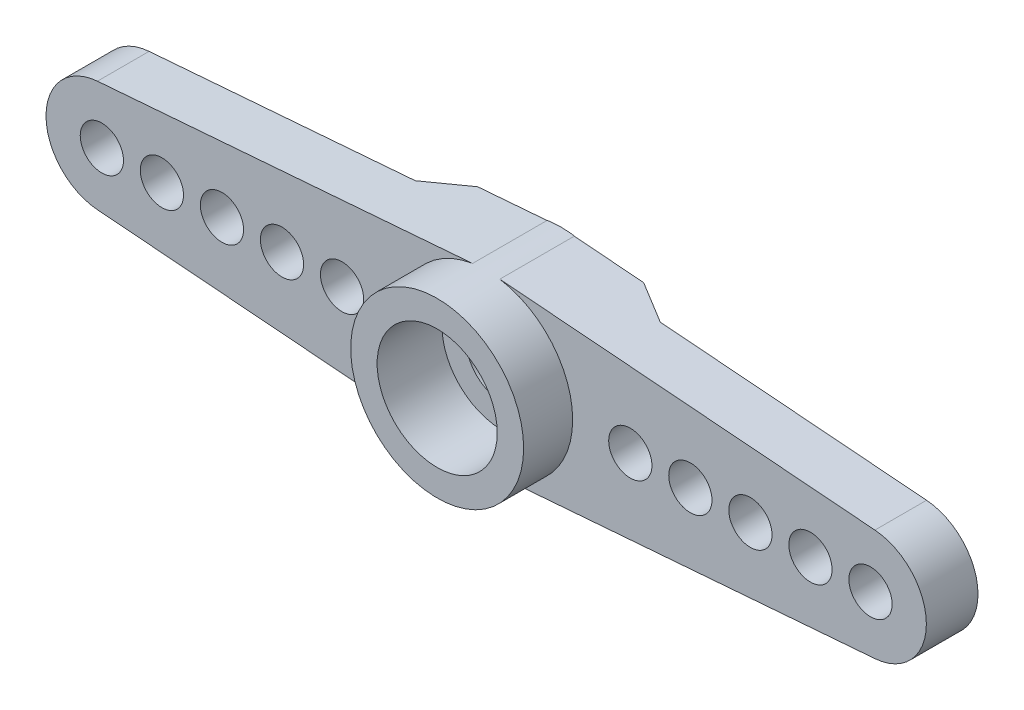
from build123d import *
from build123d.topology import SkipClean

# Parameters (mm, degrees)
RESSALTO_EXTRUS_O1_DEPTH      = 2.8
RESSALTO_EXTRUS_O1_DEPTH_BACK = 0.15
ESBO_O1_R                     = 3.6
ESBO_O1_R_2                   = 2.45
ESBO_O2_R                     = 2.5
ESBO_O2_R_2                   = 1
RESSALTO_EXTRUS_O2_DEPTH      = 0.5
ESBO_O3_R                     = 3.6
ESBO_O3_R_2                   = 2.45
RESSALTO_EXTRUS_O3_DEPTH      = 2.2
ESBO_O4_W                     = 22
ESBO_O4_H                     = 2.15
RESSALTO_EXTRUS_O4_DEPTH      = 3.6
ESBO_O5_W                     = 28.099055456
ESBO_O5_H                     = 12.161315405
CORTE_EXTRUS_O2_DEPTH         = 7.2
ESBO_O7_R                     = 2.5
CORTE_EXTRUS_O3_DEPTH         = 2.7
ESBO_O8_R                     = 1.5
ESBO_O8_R_2                   = 0.9
CORTE_EXTRUS_O4_DEPTH         = 6.9
RESSALTO_EXTRUS_O5_START      = 0.95
RESSALTO_EXTRUS_O5_DEPTH      = 0.95
CORTE_EXTRUS_O5_DEPTH         = 12
CORTE_EXTRUS_O5_DEPTH_BACK    = 4.95


with BuildPart() as part:
    # Esboço1 → Ressalto-extrusão1 (new, two sides: drawn at the far end of the back side and taken through both)
    with BuildSketch(Plane.XY.offset(-RESSALTO_EXTRUS_O1_DEPTH_BACK)):
        Circle(ESBO_O1_R)
        Circle(ESBO_O1_R_2, mode=Mode.SUBTRACT)
    extrude(amount=RESSALTO_EXTRUS_O1_DEPTH + RESSALTO_EXTRUS_O1_DEPTH_BACK)



with BuildPart() as body_2:
    # Esboço2 → Ressalto-extrusão2 (new body)
    with BuildSketch(Plane(origin=(0, 0, -0.15), x_dir=(-1, 0, 0), z_dir=(0, 0, -1))):
        Circle(ESBO_O2_R)
        Circle(ESBO_O2_R_2, mode=Mode.SUBTRACT)
    extrude(amount=RESSALTO_EXTRUS_O2_DEPTH)


with BuildPart() as part_1:
    add(part.part)

    add(body_2.part)  # Ressalto-extrusão3 merges body 2
    # Esboço3 → Ressalto-extrusão3 (add)
    with BuildSketch(Plane(origin=(0, 0, -0.15), x_dir=(-1, 0, 0), z_dir=(0, 0, -1))):
        Circle(ESBO_O3_R)
        Circle(ESBO_O3_R_2, mode=Mode.SUBTRACT)
    extrude(amount=RESSALTO_EXTRUS_O3_DEPTH)

    # Esboço4 → Ressalto-extrusão4 (add, symmetric)
    with BuildSketch(Plane(origin=(0, 0, 0), x_dir=(1, 0, 0), z_dir=(0, 1, 0))):
        with Locations((-7.325, 0.315)):
            Rectangle(ESBO_O4_W, ESBO_O4_H)
    extrude(amount=RESSALTO_EXTRUS_O4_DEPTH, both=True)

    # Esboço5 → Corte-extrusão2 (cut)
    with BuildSketch(Plane.XY.offset(0.76)):
        with Locations((-8.404041895, -0.464906197)):
            Rectangle(ESBO_O5_W, ESBO_O5_H)
        with BuildLine():
            ThreePointArc((0, -3.6), (-0.28434443, -3.588753021), (-0.566912184, -3.555082358))
            Line((-0.566912184, -3.555082358), (-16.183639111, -2.317736326))
            ThreePointArc((-16.183639111, -2.317736326), (-18.325, 0), (-16.183639111, 2.317736326))
            Line((-16.183639111, 2.317736326), (-0.566912184, 3.555082358))
            ThreePointArc((-0.566912184, 3.555082358), (-0.28434443, 3.588753021), (0, 3.6))
            ThreePointArc((0, 3.6), (3.6, 0), (0, -3.6))
        make_face(mode=Mode.SUBTRACT)
    extrude(amount=-CORTE_EXTRUS_O2_DEPTH, mode=Mode.SUBTRACT)

    # Esboço7 → Corte-extrusão3 (cut)
    with BuildSketch(Plane.XY.offset(2.8)):
        Circle(ESBO_O7_R)
    extrude(amount=-CORTE_EXTRUS_O3_DEPTH, mode=Mode.SUBTRACT)

    # Esboço8 → Corte-extrusão4 (cut, symmetric)
    with BuildSketch(Plane.XY.offset(0.1)):
        Circle(ESBO_O8_R)
        with Locations((-6, 0)):
            Circle(ESBO_O8_R_2)
        with Locations((-8.5, 0)):
            Circle(ESBO_O8_R_2)
        with Locations((-11, 0)):
            Circle(ESBO_O8_R_2)
        with Locations((-13.5, 0)):
            Circle(ESBO_O8_R_2)
        with Locations((-16, 0)):
            Circle(ESBO_O8_R_2)
    extrude(amount=CORTE_EXTRUS_O4_DEPTH, both=True, mode=Mode.SUBTRACT)

    # Esboço10 → Ressalto-extrusão5 (add)
    with SkipClean():  # the faces are left unmerged after this step: merging them gives an invalid solid
        with BuildSketch(Plane(origin=(0, 0, -1.39), x_dir=(-1, 0, 0), z_dir=(0, 0, -1)).offset(RESSALTO_EXTRUS_O5_START)):
            with BuildLine():
                Line((0.566912184, -3.555082358), (5.1, -3.195916302))
                Line((5.1, -3.195916302), (5.1, -2.395916302))
                Line((5.1, -2.395916302), (2.686928558, -2.395916302))
                ThreePointArc((2.686928558, -2.395916302), (1.727074515, -3.158672763), (0.566912184, -3.555082358))
            make_face()
            with BuildLine():
                ThreePointArc((0.566912184, 3.555082358), (1.727074515, 3.158672763), (2.686928558, 2.395916302))
                Line((2.686928558, 2.395916302), (5.1, 2.395916302))
                Line((5.1, 2.395916302), (5.1, 3.195916302))
                Line((5.1, 3.195916302), (0.566912184, 3.555082358))
            make_face()
            with BuildLine():
                ThreePointArc((3.577708764, 0.4), (3.6, 0), (3.577708764, -0.4))
                Line((3.577708764, -0.4), (5.193774225, -0.4))
                ThreePointArc((5.193774225, -0.4), (5.1, 0), (5.193774225, 0.4))
                Line((5.193774225, 0.4), (3.577708764, 0.4))
            make_face()
        extrude(amount=-RESSALTO_EXTRUS_O5_DEPTH)

    # Esboço11 → Corte-extrusão5 (cut, two sides: drawn at the far end of the back side and taken through both)
    with BuildSketch(Plane(origin=(0, 0, 0), x_dir=(1, 0, 0), z_dir=(0, 1, 0)).offset(-CORTE_EXTRUS_O5_DEPTH_BACK)):
        Polygon((-5.1, 1.39), (-2.045555334, 3.15348445), (-5.859008957, 3.15348445), (-5.859008957, 1.39), align=None)
    extrude(amount=CORTE_EXTRUS_O5_DEPTH + CORTE_EXTRUS_O5_DEPTH_BACK, mode=Mode.SUBTRACT)

    # Espelhar20: part across plane


with BuildPart() as part_2:
    add(part_1.part)
    add(part_1.part.mirror(Plane.ZY))


solid = part_2.part
